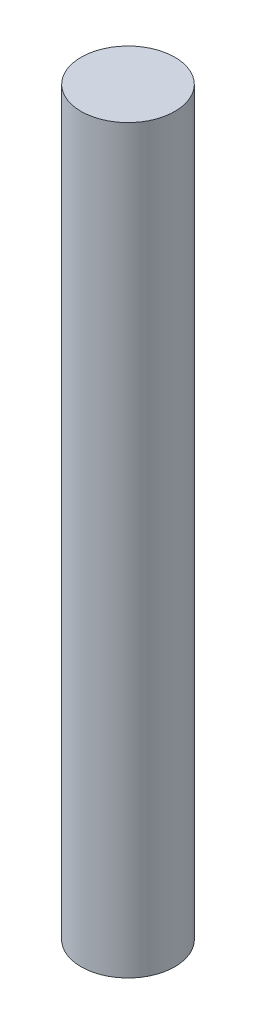
from build123d import *

# Parameters (mm, degrees)
SKETCH1_R           = 4.826
BOSS_EXTRUDE1_DEPTH = 76.2


with BuildPart() as part:
    # Sketch1 → Boss-Extrude1 (new body)
    with BuildSketch(Plane(origin=(0, 0, 0), x_dir=(1, 0, 0), z_dir=(0, 1, 0))):
        with Locations((1.949810434, -0.24891883)):
            Circle(SKETCH1_R)
    extrude(amount=BOSS_EXTRUDE1_DEPTH)


solid = part.part
